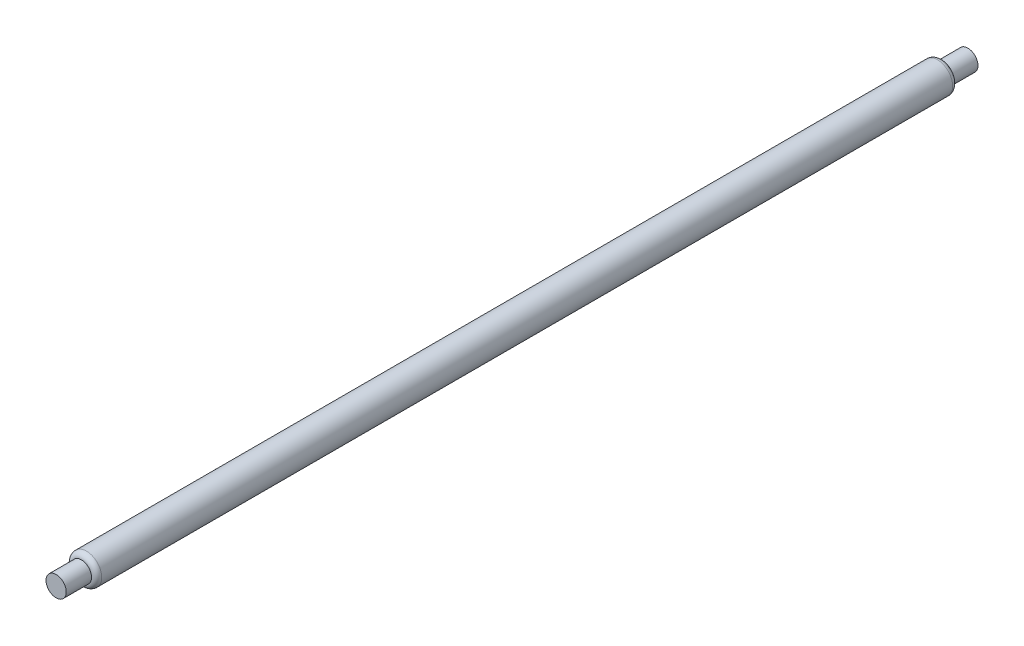
from build123d import *

# Parameters (mm, degrees)
SKETCH1_R            = 6
BOSS_EXTRUDE1_DEPTH  = 180
SKETCH2_R            = 6
SKETCH2_R_2          = 4
CUT_EXTRUDE1_DEPTH   = 10
FILLET1_R            = 2
FILLET1_OF_MIRROR1_R = 2


with BuildPart() as part:
    # Sketch1 → Boss-Extrude1 (new, symmetric)
    with BuildSketch(Plane.XY):
        with Locations(Location((0, 0, 0), (0, 0, 180))):
            Circle(SKETCH1_R)
    extrude(amount=BOSS_EXTRUDE1_DEPTH, both=True)

    # Sketch2 → Cut-Extrude1 (cut)
    with BuildSketch(Plane.XY.offset(180)):
        with Locations(Location((0, 0, 0), (0, 0, 180))):
            Circle(SKETCH2_R)
        Circle(SKETCH2_R_2, mode=Mode.SUBTRACT)
    cut_extrude1 = extrude(amount=-CUT_EXTRUDE1_DEPTH, mode=Mode.SUBTRACT)

    # Fillet1
    fillet1_edges = [part.edges().sort_by_distance(p)[0] for p in [
        (6, 0, 170),
    ]]
    fillet(fillet1_edges, radius=FILLET1_R - 0.0001)  # a hair under: the kernel refuses the full size

    # Mirror1: Cut-Extrude1 across plane
    add(cut_extrude1.mirror(Plane.XY), mode=Mode.SUBTRACT)

    # Fillet1 of Mirror1
    fillet1_of_mirror1_edges = [part.edges().sort_by_distance(p)[0] for p in [
        (6, 0, -170),
    ]]
    fillet(fillet1_of_mirror1_edges, radius=FILLET1_OF_MIRROR1_R - 0.0001)  # a hair under: the kernel refuses the full size


solid = part.part
